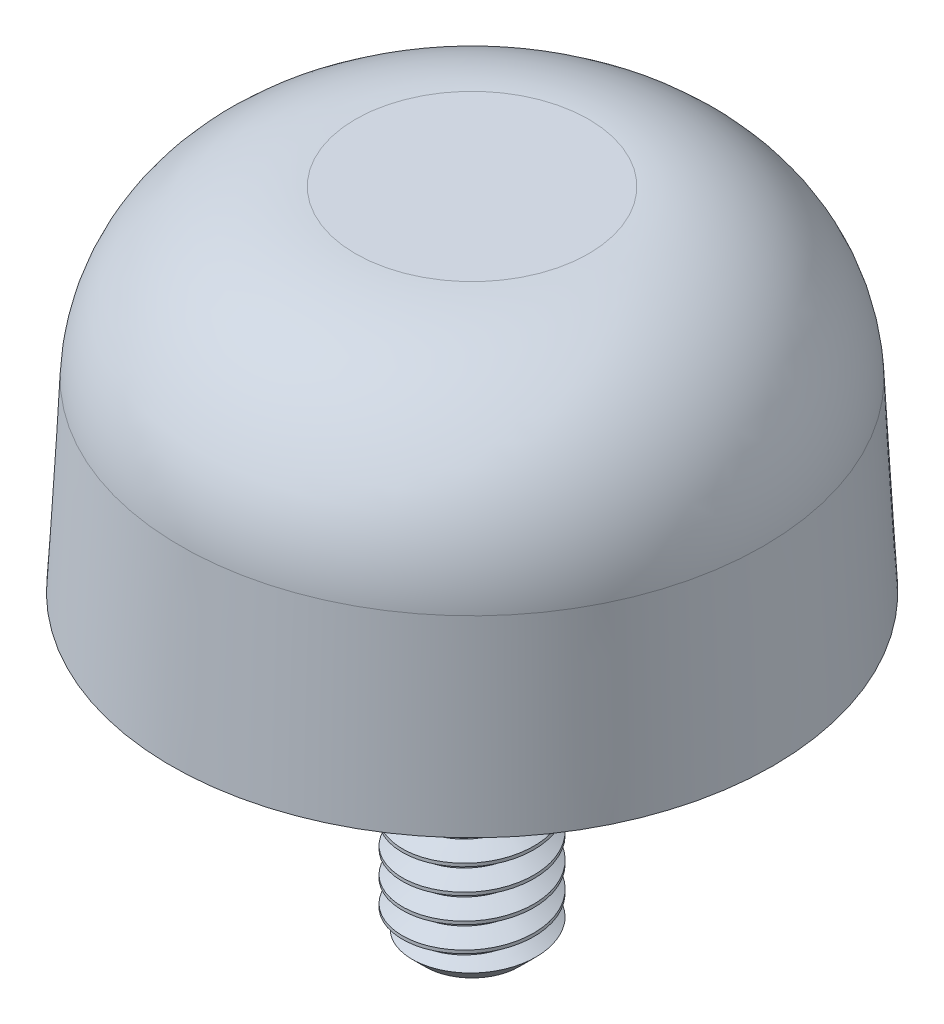
from build123d import *

# Parameters (mm, degrees)
CHAMFER1_SIZE    = 0.5953125
CUT_SWEEP1_PITCH = 0.79375


with BuildPart() as part:
    # Sketch2 → Revolve1 (revolve)
    with BuildSketch(Plane.XY):
        with BuildLine():
            Line((0, -9.525), (0, 11.1125))
            Line((0, 11.1125), (3.688011954, 11.1125))
            ThreePointArc((3.688011954, 11.1125), (7.49956891, 9.591842967), (9.217623414, 5.865094657))
            Line((9.217623414, 5.865094657), (9.525, 0))
            Line((9.525, 0), (2.0828, 0))
            Line((2.0828, 0), (2.0828, -9.525))
            Line((2.0828, -9.525), (0, -9.525))
        make_face()
    revolve(axis=Axis((0, -9.525, 0), (0, 1, 0)))

    # Chamfer1
    chamfer1_edges = [part.edges().sort_by_distance(p)[0] for p in [
        (-2.0828, -9.525, 0),
    ]]
    chamfer(chamfer1_edges, length=CHAMFER1_SIZE)

    # Cut-Sweep1: the profile of Sketch4 profile screwed along a right-hand helix of 13 turns, 8 arcs to a turn; built about Z, then put on its axis
    cut_sweep1_z = Axis((0, 0, 0), (0, 0, 1))
    cut_sweep1_corners = [(2.0831, 0, 0.000173205), (2.0831, 0, -0.694704455), (1.567244252, 0, -0.396875), (1.567244252, 0, -0.29765625)]
    with BuildLine(mode=Mode.PRIVATE) as cut_sweep1_profile:
        Line(cut_sweep1_corners[0], cut_sweep1_corners[1])
        Line(cut_sweep1_corners[1], cut_sweep1_corners[2])
        Line(cut_sweep1_corners[2], cut_sweep1_corners[3])
        Line(cut_sweep1_corners[3], cut_sweep1_corners[0])
    cut_sweep1_cap = Face(cut_sweep1_profile.wire())
    cut_sweep1_turn_angles = [0, 22.5, 45, 67.5, 90, 112.5, 135, 157.5, 180, 202.5, 225, 247.5, 270, 292.5, 315, 337.5, 360]
    cut_sweep1_turn_weights = [1, 0.9238795325112867, 1, 0.9238795325112867, 1, 0.9238795325112867, 1, 0.9238795325112867, 1, 0.9238795325112867, 1, 0.9238795325112867, 1, 0.9238795325112867, 1, 0.9238795325112867, 1]
    cut_sweep1_turn_rails = [Edge.make_bspline([Vector(p[0], p[1], 0).rotate(cut_sweep1_z, cut_sweep1_turn_angles[k]) / cut_sweep1_turn_weights[k] + Vector(0, 0, p[2] + CUT_SWEEP1_PITCH * cut_sweep1_turn_angles[k] / 360) for k in range(17)], [0, 0, 0, 1, 1, 2, 2, 3, 3, 4, 4, 5, 5, 6, 6, 7, 7, 8, 8, 8], 2, cut_sweep1_turn_weights) for p in cut_sweep1_corners]
    cut_sweep1_turn_sides = [Face.make_surface_from_curves(cut_sweep1_turn_rails[p[0]], cut_sweep1_turn_rails[p[1]]) for p in [(0, 1), (1, 2), (2, 3), (3, 0)]]
    cut_sweep1 = Plane(origin=(0, -9.525, 0), x_dir=(-1, 0, 0), z_dir=(0, 1, 0)) * Solid(Shell([*[p.moved(Location((0, 0, CUT_SWEEP1_PITCH * i))) for i in range(13) for p in cut_sweep1_turn_sides], cut_sweep1_cap, cut_sweep1_cap.rotate(cut_sweep1_z, 4680).moved(Location((0, 0, CUT_SWEEP1_PITCH * 4680 / 360)))]))
    add(cut_sweep1, mode=Mode.SUBTRACT)


solid = part.part
